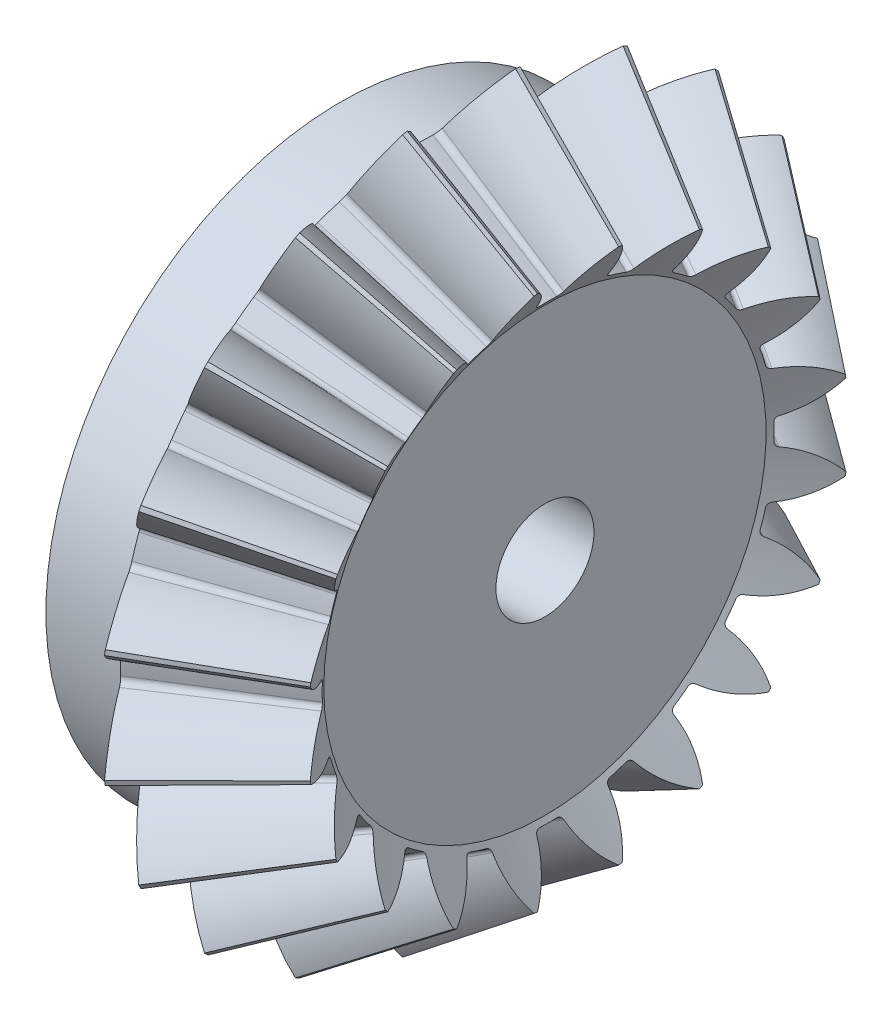
from build123d import *

# Parameters (mm, degrees)
TEETHCUTS_COUNT = 20
TEETHCUTS_ANGLE = 342
HUBSKE_R        = 38.175007904
HUB_DEPTH       = 9.927884647
BORSKE_R        = 6.35
BORE_DEPTH      = 76.2000508


with BuildPart() as part:
    # BasProSke → Base-Revolve (revolve)
    with BuildSketch(Plane(origin=(0, 0, 0), x_dir=(1, 0, 0), z_dir=(0, 1, 0)), mode=Mode.PRIVATE) as base_revolve_sk:
        Polygon((0, 0), (0, 38.175007906), (5.720551224, 46.755834729), (20.835160604, 35.084872903), (16.542545281, 28.645949927), (16.542545281, 0), align=None)
    revolve(base_revolve_sk.sketch.rotate(Axis((-10, 0, 0), (1, 0, 0)), 180), axis=Axis((-10, 0, 0), (1, 0, 0)))

    # ToothCut: read off the stored shape, not the designer's step
    # ToothCut: loft between two sections, ruled curve by curve
    toothcut_from = [
        Edge.make_bspline([(66.276547577, 0.006495933, -0.010016874), (66.273335532, 0.001677864, -0.014530089), (66.269290014, -0.004390412, -0.013687511), (66.266733417, -0.008225308, -0.007972837)], [0, 0, 0, 0, 1, 1, 1, 1], 3, [1, 0.808644848, 0.808644848, 1]),
        Edge.make_bspline([(66.266733417, -0.008225308, 0.007972837), (66.269290014, -0.004390412, 0.013687511), (66.273335532, 0.001677864, 0.014530089), (66.276547577, 0.006495933, 0.010016874)], [0, 0, 0, 0, 1, 1, 1, 1], 3, [1, 0.808644848, 0.808644848, 1]),
        Edge.make_bspline([(66.266733417, -0.008225308, -0.007972837), (66.26631293, -0.008856039, -0.007032936), (66.265970538, -0.009369626, -0.005995129), (66.265713149, -0.009755711, -0.004880349)], [0, 0, 0, 0, 1, 1, 1, 1], 3, [1, 0.993277033, 0.993277033, 1]),
        Edge.make_bspline([(66.265713149, -0.009755711, 0.004880349), (66.265970538, -0.009369626, 0.005995129), (66.26631293, -0.008856039, 0.007032936), (66.266733417, -0.008225308, 0.007972837)], [0, 0, 0, 0, 1, 1, 1, 1], 3, [1, 0.993277033, 0.993277033, 1]),
        Edge.make_bspline([(66.265713149, -0.009755711, -0.004880349), (66.264982203, -0.01085213, -0.001714549), (66.264982203, -0.01085213, 0.001714549), (66.265713149, -0.009755711, 0.004880349)], [0, 0, 0, 0, 1, 1, 1, 1], 3, [1, 0.948811212, 0.948811212, 1]),
        Edge.make_line((66.276547577, 0.006495933, 0.010016874), (66.276547577, 0.006495933, -0.010016874)),
    ]
    toothcut_to = [
        Edge.make_bspline([(5.895298547, 47.017955713, -7.848739706), (4.587979653, 45.056977375, -5.072208593), (2.865523919, 42.473293778, -3.169219084), (0.899762785, 39.524652081, -2.32961259)], [0, 0, 0, 0, 1, 1, 1, 1], 3, [1, 0.966746811, 0.966746811, 1]),
        Edge.make_bspline([(0.899762785, 39.524652081, 2.32961259), (2.865523919, 42.473293778, 3.169219084), (4.587979653, 45.056977375, 5.072208593), (5.895298547, 47.017955713, 7.848739706)], [0, 0, 0, 0, 1, 1, 1, 1], 3, [1, 0.966746811, 0.966746811, 1]),
        Edge.make_bspline([(0.899762785, 39.524652081, -2.32961259), (0.67160135, 39.18240993, -2.232161369), (0.529724358, 38.969594442, -1.895613367), (0.538735293, 38.983110845, -1.473215237)], [0, 0, 0, 0, 1, 1, 1, 1], 3, [1, 0.848217142, 0.848217142, 1]),
        Edge.make_bspline([(0.538735293, 38.983110845, 1.473215237), (0.529724358, 38.969594442, 1.895613367), (0.67160135, 39.18240993, 2.232161369), (0.899762785, 39.524652081, 2.32961259)], [0, 0, 0, 0, 1, 1, 1, 1], 3, [1, 0.848217142, 0.848217142, 1]),
        Edge.make_bspline([(0.538735293, 38.983110845, -1.473215237), (0.559682004, 39.01453091, -0.491313701), (0.559682004, 39.01453091, 0.491313701), (0.538735293, 38.983110845, 1.473215237)], [0, 0, 0, 0, 1, 1, 1, 1], 3, [1, 0.999507534, 0.999507534, 1]),
        Edge.make_line((5.895298547, 47.017955713, 7.848739706), (5.895298547, 47.017955713, -7.848739706)),
    ]
    toothcut = Solid(Shell([*[Face.make_surface_from_curves(toothcut_from[k], toothcut_to[k]) for k in range(6)], Face(Wire(toothcut_from)), Face(Wire(toothcut_to))]))
    add(toothcut, mode=Mode.SUBTRACT)

    # TeethCuts: ToothCut ×20 about axis
    teethcuts_axis = Axis((-10, 0, 0), (1, 0, 0))
    for i in range(1, TEETHCUTS_COUNT):
        add(toothcut.rotate(teethcuts_axis, i * TEETHCUTS_ANGLE / (TEETHCUTS_COUNT - 1)), mode=Mode.SUBTRACT)

    # HubSke → Hub (add)
    with BuildSketch(Plane.ZY):
        with Locations(Location((0, 0, 0), (0, 0, 180))):
            Circle(HUBSKE_R)
    extrude(amount=HUB_DEPTH)

    # BorSke → Bore (cut, symmetric)
    with BuildSketch(Plane(origin=(0, 0, 0), x_dir=(0, 0, -1), z_dir=(1, 0, 0))):
        with Locations(Location((0, 0, 0), (0, 0, 180))):
            Circle(BORSKE_R)
    extrude(amount=BORE_DEPTH, both=True, mode=Mode.SUBTRACT)


solid = part.part
